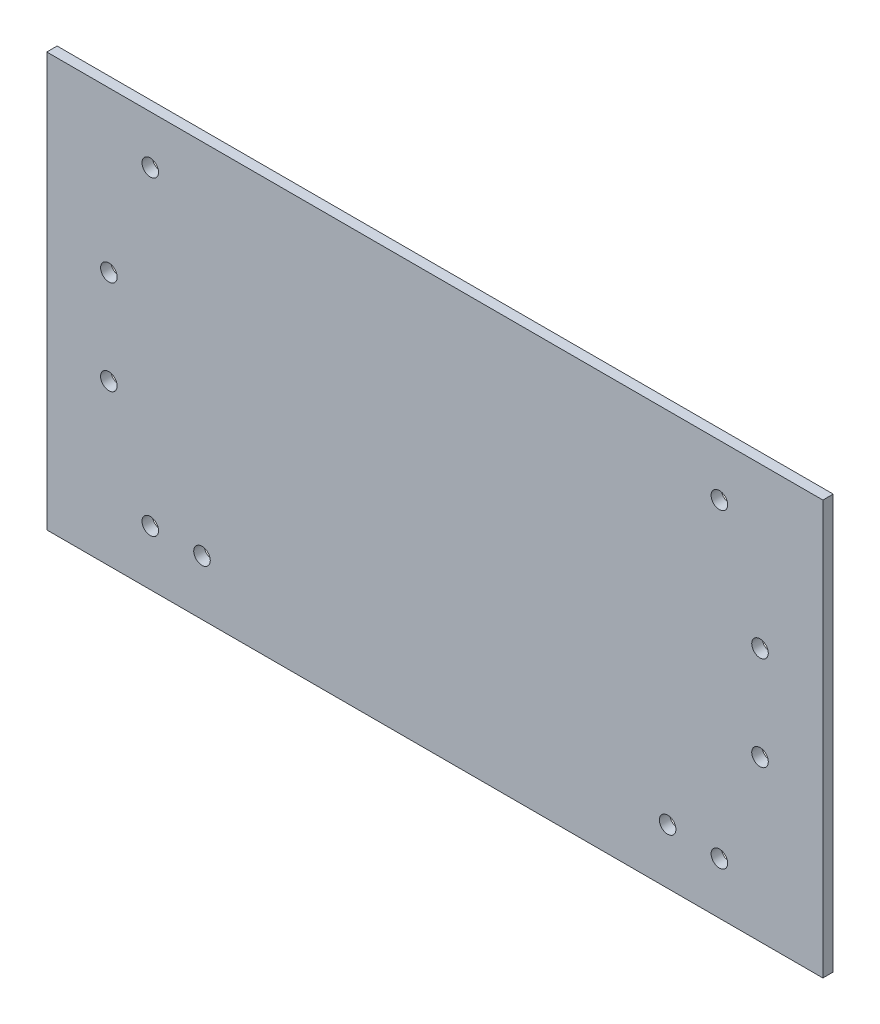
from build123d import *

# Parameters (mm, degrees)
SKETCH1_W           = 150
SKETCH1_H           = 80
SKETCH1_R           = 1.6
BOSS_EXTRUDE1_DEPTH = 2


with BuildPart() as part:
    # Sketch1 → Boss-Extrude1 (new body)
    with BuildSketch(Plane.XY):
        Rectangle(SKETCH1_W, SKETCH1_H)
        with Locations((-55, -29.333333333)):
            Circle(SKETCH1_R, mode=Mode.SUBTRACT)
        with Locations((-45, -29.333333333)):
            Circle(SKETCH1_R, mode=Mode.SUBTRACT)
        with Locations((-63, -9.1)):
            Circle(SKETCH1_R, mode=Mode.SUBTRACT)
        with Locations((-63, 9.1)):
            Circle(SKETCH1_R, mode=Mode.SUBTRACT)
        with Locations((-55, 30.666666667)):
            Circle(SKETCH1_R, mode=Mode.SUBTRACT)
        with Locations((55, 30)):
            Circle(SKETCH1_R, mode=Mode.SUBTRACT)
        with Locations((55, -30)):
            Circle(SKETCH1_R, mode=Mode.SUBTRACT)
        with Locations((45, -29.333333333)):
            Circle(SKETCH1_R, mode=Mode.SUBTRACT)
        with Locations((62.85, -9.1)):
            Circle(SKETCH1_R, mode=Mode.SUBTRACT)
        with Locations((62.85, 9.1)):
            Circle(SKETCH1_R, mode=Mode.SUBTRACT)
    extrude(amount=BOSS_EXTRUDE1_DEPTH)


solid = part.part
